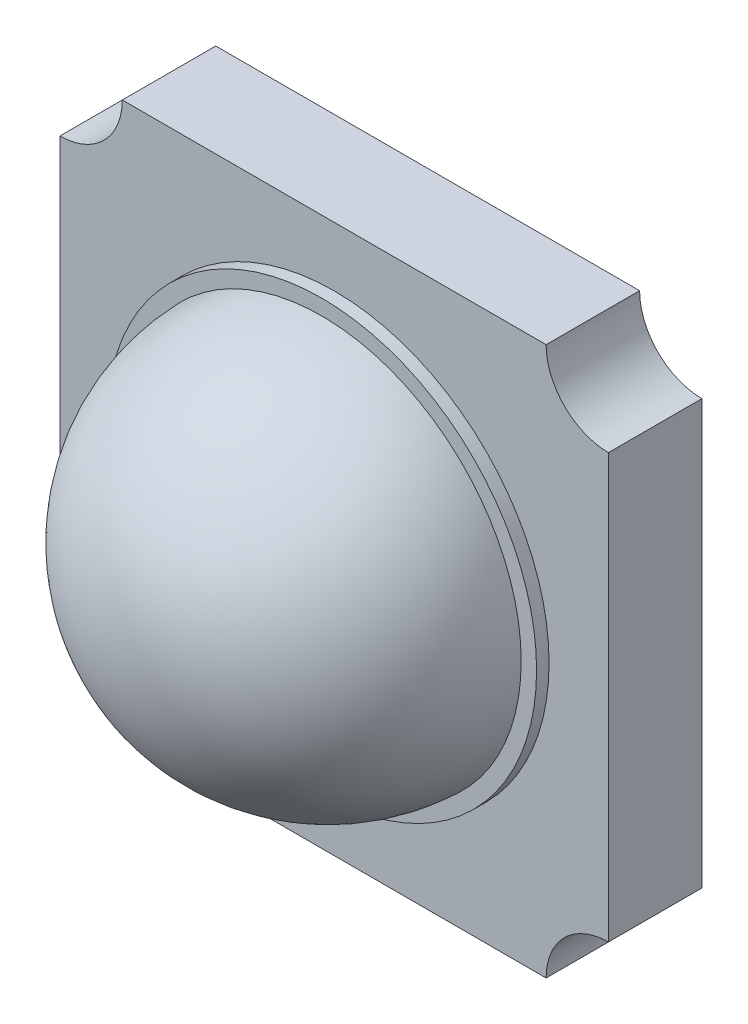
from build123d import *

# Parameters (mm, degrees)
P_IDAT_VYSUNUT_M1_DEPTH = 0.75
SKICA4_R                = 1.723681802
P_IDAT_VYSUNUT_M3_DEPTH = 0.1
SKICA5_R                = 1.6
P_IDAT_VYSUNUT_M4_DEPTH = 1.65
ZAOBLIT7_R              = 1.6


with BuildPart() as part:
    # Skica1 → Přidat vysunutím1 (new body)
    with BuildSketch(Plane.XY):
        with BuildLine():
            Line((-51.651331746, 37.07927242), (-48.251331746, 37.07927242))
            ThreePointArc((-48.251331746, 37.07927242), (-48.104885136, 36.725719029), (-47.751331746, 36.57927242))
            Line((-47.751331746, 36.57927242), (-47.751331746, 33.17927242))
            ThreePointArc((-47.751331746, 33.17927242), (-48.104885136, 33.03282581), (-48.251331746, 32.67927242))
            Line((-48.251331746, 32.67927242), (-51.651331746, 32.67927242))
            ThreePointArc((-51.651331746, 32.67927242), (-51.797778355, 33.03282581), (-52.151331746, 33.17927242))
            Line((-52.151331746, 33.17927242), (-52.151331746, 36.57927242))
            ThreePointArc((-52.151331746, 36.57927242), (-51.797778355, 36.725719029), (-51.651331746, 37.07927242))
        make_face()
    extrude(amount=P_IDAT_VYSUNUT_M1_DEPTH)

    # Skica4 → Přidat vysunutím3 (add)
    with BuildSketch(Plane.XY.offset(0.75)):
        with Locations((-49.951331746, 34.87927242)):
            Circle(SKICA4_R)
    extrude(amount=P_IDAT_VYSUNUT_M3_DEPTH)

    # Skica5 → Přidat vysunutím4 (add)
    with BuildSketch(Plane.XY.offset(0.75)):
        with Locations((-49.951331746, 34.87927242)):
            Circle(SKICA5_R)
    extrude(amount=P_IDAT_VYSUNUT_M4_DEPTH)

    # Zaoblit7
    # the kernel refuses this fillet: 1.6 mm, written as the material it takes off along each edge
    with BuildSketch(Plane(origin=(-49.951331746, 34.87927242, 2.4), x_dir=(1, 0, 0), z_dir=(0, -1, 0))) as zaoblit7_piece_1:
        with BuildLine():
            CenterArc((0.000781441, -1.6), ZAOBLIT7_R, 1.790784659, 88.209215341)
            Line((0.000781441, 0), (0.000781441, 0.032))
            Line((0.000781441, 0.032), (1.6, 0.032))
            Line((1.6, 0.032), (1.632, 0))
            ThreePointArc((1.632, 0), (1.632, -0.775), (1.631984371, -1.549))
            Line((1.631984371, -1.549), (1.6, -1.55))
        make_face()
    revolve(axis=Axis((-49.951331746, 34.87927242, 2.4), (0, 0, 1)), mode=Mode.SUBTRACT)


solid = part.part
